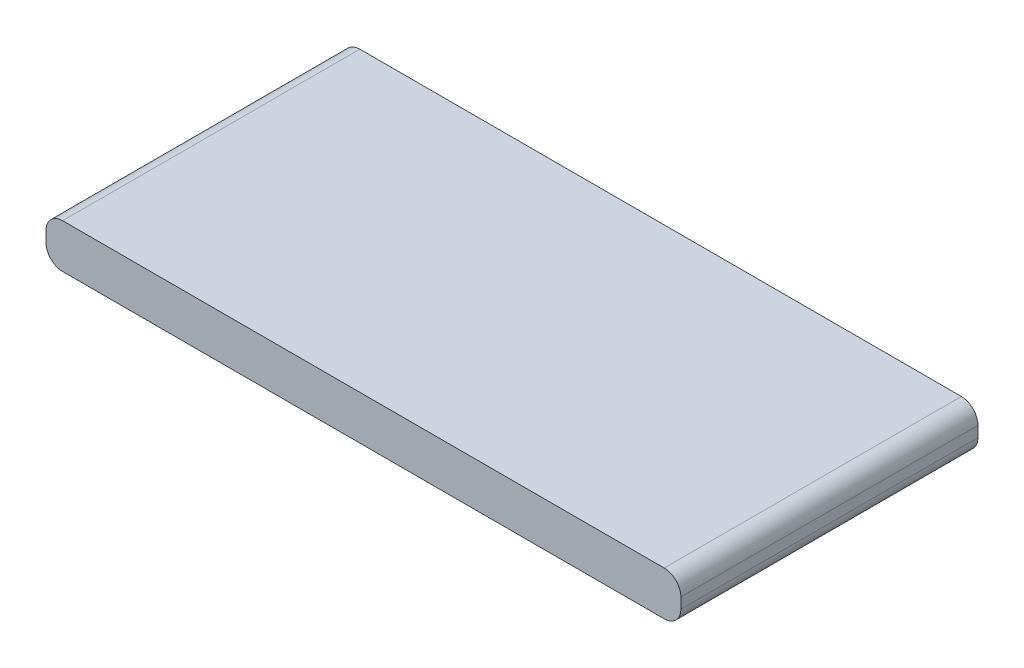
from build123d import *

# Parameters (mm, degrees)
SKETCH2_W           = 114.3
SKETCH2_H           = 7.924066875
BOSS_EXTRUDE1_DEPTH = 53.499999934
FILLET1_R           = 3


with BuildPart() as part:
    # Sketch2 → Boss-Extrude1 (new body)
    with BuildSketch(Plane.XY):
        with Locations((57.15, 3.962033438)):
            Rectangle(SKETCH2_W, SKETCH2_H)
    extrude(amount=BOSS_EXTRUDE1_DEPTH)

    # Fillet1
    fillet1_edges = [part.edges().sort_by_distance(p)[0] for p in [
        (114.3, 7.924066875, 26.749999967),
        (114.3, 0, 26.749999967),
        (0, 7.924066875, 26.749999967),
        (0, 0, 26.749999967),
    ]]
    fillet(fillet1_edges, radius=FILLET1_R)


solid = part.part
